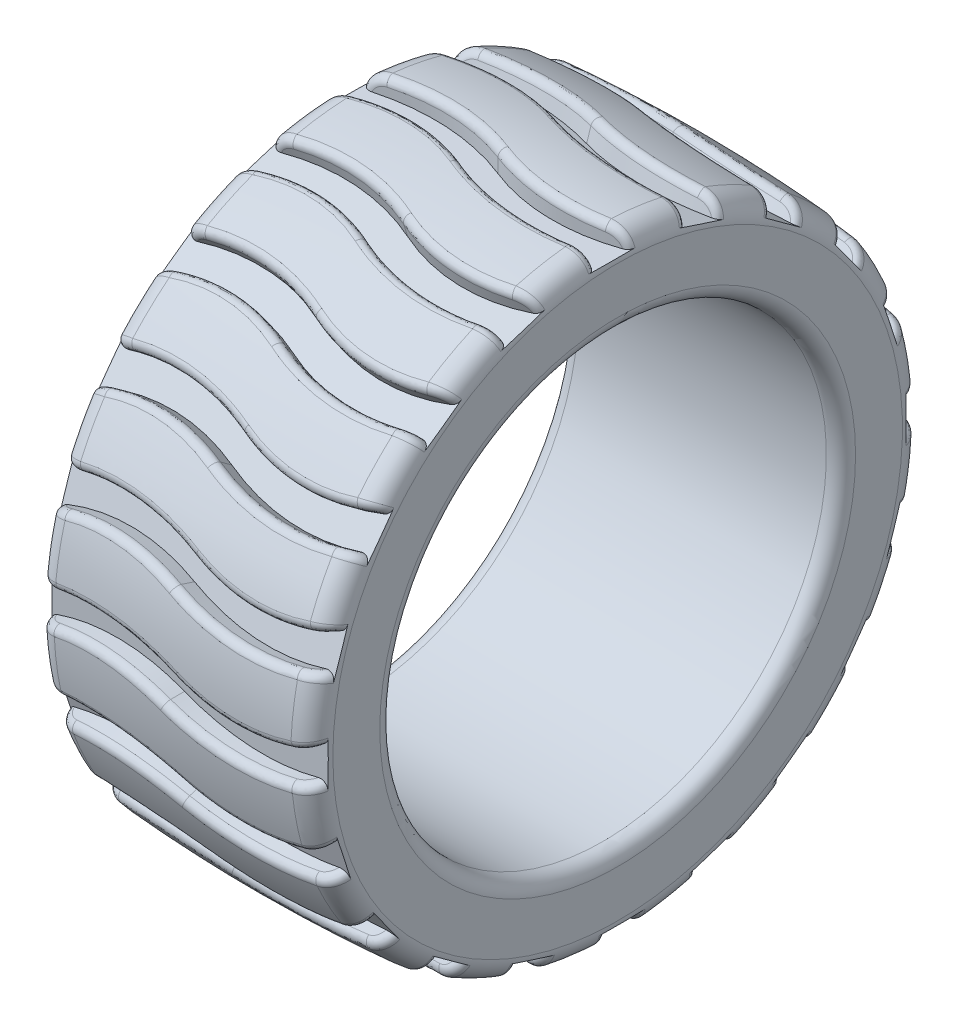
from build123d import *

# Parameters (mm, degrees)
CONG_1_R                           = 1.5
CONG_2_R                           = 1
ENL_V_START                        = 21.3
ENL_V_MAT_EXTRU_1_DEPTH            = 1.5
CONG_3_R                           = 0.5
R_P_TITION_CIRCULAIRE1_COUNT       = 20
CONG_3_OF_R_P_TITION_CIRCULAIRE1_R = 0.5


with BuildPart() as part:
    # Esquisse1 → Révolution1 (revolve)
    with BuildSketch(Plane.XY, mode=Mode.PRIVATE) as r_volution1_sk:
        with BuildLine():
            Line((-9.5, 20.9), (-9.5, 15.3))
            Line((-9.5, 15.3), (9.5, 15.3))
            Line((9.5, 15.3), (9.5, 20.9))
            ThreePointArc((9.5, 20.9), (0, 21.3), (-9.5, 20.9))
        make_face()
    revolve(r_volution1_sk.sketch.rotate(Axis((-10.45, 0, 0), (1, 0, 0)), 90), axis=Axis((-10.45, 0, 0), (1, 0, 0)))

    # Congé1
    cong_1_edges = [part.edges().sort_by_distance(p)[0] for p in [
        (-9.5, 0, -20.9),
        (9.5, 0, -20.9),
    ]]
    fillet(cong_1_edges, radius=CONG_1_R)

    # Congé2
    cong_2_edges = [part.edges().sort_by_distance(p)[0] for p in [
        (-9.5, 0, -15.3),
        (9.5, 0, -15.3),
    ]]
    fillet(cong_2_edges, radius=CONG_2_R)

    # Esquisse3 → Enlèv. mat.-Extru.1 (cut)
    with BuildSketch(Plane(origin=(0, 0, 0), x_dir=(1, 0, 0), z_dir=(0, 1, 0)).offset(ENL_V_START)):
        with BuildLine():
            Line((-9.628981596, -0.928625513), (-10.371018404, 0.928625513))
            ThreePointArc((-10.371018404, 0.928625513), (-5, 1.961872591), (0.371018404, 0.928625513))
            ThreePointArc((0.371018404, 0.928625513), (5, 0.038127409), (9.628981596, 0.928625513))
            Line((9.628981596, 0.928625513), (10.371018404, -0.928625513))
            ThreePointArc((10.371018404, -0.928625513), (5, -1.961872591), (-0.371018404, -0.928625513))
            ThreePointArc((-0.371018404, -0.928625513), (-5, -0.038127409), (-9.628981596, -0.928625513))
        make_face()
    enl_v_mat_extru_1 = extrude(amount=-ENL_V_MAT_EXTRU_1_DEPTH, mode=Mode.SUBTRACT)

    # Congé3
    cong_3_edges = [part.edges().sort_by_distance(p)[0] for p in [
        (-8.98199894, 20.634990629, 0.690641919),
        (-8.974112077, 20.605433709, -1.405695754),
        (8.974112924, 20.605435371, 1.405695512),
        (8.981998412, 20.6349899, -0.690641741),
        (3.817385363, 21.14912319, 1.913486356),
        (-4.202402626, 21.221743744, 0.063648066),
        (-3.817385436, 21.149123187, -1.913486362),
        (4.202402654, 21.221743743, -0.063648065),
    ]]
    fillet(cong_3_edges, radius=CONG_3_R)

    # Répétition circulaire1: Enlèv. mat.-Extru.1 ×20 about axis
    r_p_tition_circulaire1_axis = Axis((-10.45, 0, 0), (1, 0, 0))
    for i in range(1, R_P_TITION_CIRCULAIRE1_COUNT):
        add(enl_v_mat_extru_1.rotate(r_p_tition_circulaire1_axis, i * 360 / R_P_TITION_CIRCULAIRE1_COUNT), mode=Mode.SUBTRACT)

    # Congé3 of Répétition circulaire1
    cong_3_of_r_p_tition_circulaire1_edges = [part.edges().sort_by_distance(p)[0] for p in [
        (-8.98199894, 19.411622212, 7.03340228),
        (-8.974112077, 20.031315877, 5.030533086),
        (8.974112924, 19.162549779, 7.704325583),
        (8.981998412, 19.838461643, 5.71972323),
        (3.817385363, 19.522711621, 8.355272149),
        (-4.202402626, 20.163409341, 6.618412375),
        (-3.817385436, 20.705311225, 4.715604808),
        (4.202402654, 20.202746007, 6.49734656),
        (-8.98199894, 16.288108963, 12.687684222),
        (-8.974112077, 17.496393281, 10.974338298),
        (8.974112924, 15.8439003, 13.248802586),
        (8.981998412, 17.100006537, 11.570201839),
        (3.817385363, 15.985281016, 13.97918569),
        (-4.202402626, 17.131339944, 12.525320368),
        (-3.817385436, 18.234719138, 10.883099723),
        (4.202402654, 17.206162732, 12.422335634),
        (-8.98199894, 11.570202124, 17.100007232),
        (-8.974112077, 13.248801805, 15.843898814),
        (8.974112924, 10.97433947, 17.496394483),
        (8.981998412, 12.687683649, 16.288108478),
        (3.817385363, 10.883099729, 18.234719137),
        (-4.202402626, 12.422335633, 17.206162734),
        (-3.817385436, 13.979185693, 15.98528101),
        (4.202402654, 12.525320366, 17.131339945),
        (-8.98199894, 5.719723286, 19.838462392),
        (-8.974112077, 7.704325299, 19.162548123),
        (8.974112924, 5.030533829, 20.031317383),
        (8.981998412, 7.033401886, 19.411621573),
        (3.817385363, 4.715604814, 20.705311226),
        (-4.202402626, 6.497346559, 20.202746009),
        (-3.817385436, 8.355272154, 19.522711616),
        (4.202402654, 6.618412373, 20.16340934),
        (-8.98199894, -0.690641919, 20.634990629),
        (-8.974112077, 1.405695754, 20.605433709),
        (8.974112924, -1.405695512, 20.605435371),
        (8.981998412, 0.690641741, 20.6349899),
        (3.817385363, -1.913486356, 21.14912319),
        (-4.202402626, -0.063648066, 21.221743744),
        (-3.817385436, 1.913486362, 21.149123187),
        (4.202402654, 0.063648065, 21.221743743),
        (-8.98199894, -7.03340228, 19.411622212),
        (-8.974112077, -5.030533086, 20.031315877),
        (8.974112924, -7.704325583, 19.162549779),
        (8.981998412, -5.71972323, 19.838461643),
        (3.817385363, -8.355272149, 19.522711621),
        (-4.202402626, -6.618412375, 20.163409341),
        (-3.817385436, -4.715604808, 20.705311225),
        (4.202402654, -6.49734656, 20.202746007),
        (-8.98199894, -12.687684222, 16.288108963),
        (-8.974112077, -10.974338298, 17.496393281),
        (8.974112924, -13.248802586, 15.8439003),
        (8.981998412, -11.570201839, 17.100006537),
        (3.817385363, -13.97918569, 15.985281016),
        (-4.202402626, -12.525320368, 17.131339944),
        (-3.817385436, -10.883099723, 18.234719138),
        (4.202402654, -12.422335634, 17.206162732),
        (-8.98199894, -17.100007232, 11.570202124),
        (-8.974112077, -15.843898814, 13.248801805),
        (8.974112924, -17.496394483, 10.97433947),
        (8.981998412, -16.288108478, 12.687683649),
        (3.817385363, -18.234719137, 10.883099729),
        (-4.202402626, -17.206162734, 12.422335633),
        (-3.817385436, -15.98528101, 13.979185693),
        (4.202402654, -17.131339945, 12.525320366),
        (-8.98199894, -19.838462392, 5.719723286),
        (-8.974112077, -19.162548123, 7.704325299),
        (8.974112924, -20.031317383, 5.030533829),
        (8.981998412, -19.411621573, 7.033401886),
        (3.817385363, -20.705311226, 4.715604814),
        (-4.202402626, -20.202746009, 6.497346559),
        (-3.817385436, -19.522711616, 8.355272154),
        (4.202402654, -20.16340934, 6.618412373),
        (-8.98199894, -20.634990629, -0.690641919),
        (-8.974112077, -20.605433709, 1.405695754),
        (8.974112924, -20.605435371, -1.405695512),
        (8.981998412, -20.6349899, 0.690641741),
        (3.817385363, -21.14912319, -1.913486356),
        (-4.202402626, -21.221743744, -0.063648066),
        (-3.817385436, -21.149123187, 1.913486362),
        (4.202402654, -21.221743743, 0.063648065),
        (-8.98199894, -19.411622212, -7.03340228),
        (-8.974112077, -20.031315877, -5.030533086),
        (8.974112924, -19.162549779, -7.704325583),
        (8.981998412, -19.838461643, -5.71972323),
        (3.817385363, -19.522711621, -8.355272149),
        (-4.202402626, -20.163409341, -6.618412375),
        (-3.817385436, -20.705311225, -4.715604808),
        (4.202402654, -20.202746007, -6.49734656),
        (-8.98199894, -16.288108963, -12.687684222),
        (-8.974112077, -17.496393281, -10.974338298),
        (8.974112924, -15.8439003, -13.248802586),
        (8.981998412, -17.100006537, -11.570201839),
        (3.817385363, -15.985281016, -13.97918569),
        (-4.202402626, -17.131339944, -12.525320368),
        (-3.817385436, -18.234719138, -10.883099723),
        (4.202402654, -17.206162732, -12.422335634),
        (-8.98199894, -11.570202124, -17.100007232),
        (-8.974112077, -13.248801805, -15.843898814),
        (8.974112924, -10.97433947, -17.496394483),
        (8.981998412, -12.687683649, -16.288108478),
        (3.817385363, -10.883099729, -18.234719137),
        (-4.202402626, -12.422335633, -17.206162734),
        (-3.817385436, -13.979185693, -15.98528101),
        (4.202402654, -12.525320366, -17.131339945),
        (-8.98199894, -5.719723286, -19.838462392),
        (-8.974112077, -7.704325299, -19.162548123),
        (8.974112924, -5.030533829, -20.031317383),
        (8.981998412, -7.033401886, -19.411621573),
        (3.817385363, -4.715604814, -20.705311226),
        (-4.202402626, -6.497346559, -20.202746009),
        (-3.817385436, -8.355272154, -19.522711616),
        (4.202402654, -6.618412373, -20.16340934),
        (-8.98199894, 0.690641919, -20.634990629),
        (-8.974112077, -1.405695754, -20.605433709),
        (8.974112924, 1.405695512, -20.605435371),
        (8.981998412, -0.690641741, -20.6349899),
        (3.817385363, 1.913486356, -21.14912319),
        (-4.202402626, 0.063648066, -21.221743744),
        (-3.817385436, -1.913486362, -21.149123187),
        (4.202402654, -0.063648065, -21.221743743),
        (-8.98199894, 7.03340228, -19.411622212),
        (-8.974112077, 5.030533086, -20.031315877),
        (8.974112924, 7.704325583, -19.162549779),
        (8.981998412, 5.71972323, -19.838461643),
        (3.817385363, 8.355272149, -19.522711621),
        (-4.202402626, 6.618412375, -20.163409341),
        (-3.817385436, 4.715604808, -20.705311225),
        (4.202402654, 6.49734656, -20.202746007),
        (-8.98199894, 12.687684222, -16.288108963),
        (-8.974112077, 10.974338298, -17.496393281),
        (8.974112924, 13.248802586, -15.8439003),
        (8.981998412, 11.570201839, -17.100006537),
        (3.817385363, 13.97918569, -15.985281016),
        (-4.202402626, 12.525320368, -17.131339944),
        (-3.817385436, 10.883099723, -18.234719138),
        (4.202402654, 12.422335634, -17.206162732),
        (-8.98199894, 17.100007232, -11.570202124),
        (-8.974112077, 15.843898814, -13.248801805),
        (8.974112924, 17.496394483, -10.97433947),
        (8.981998412, 16.288108478, -12.687683649),
        (3.817385363, 18.234719137, -10.883099729),
        (-4.202402626, 17.206162734, -12.422335633),
        (-3.817385436, 15.98528101, -13.979185693),
        (4.202402654, 17.131339945, -12.525320366),
        (-8.98199894, 19.838462392, -5.719723286),
        (-8.974112077, 19.162548123, -7.704325299),
        (8.974112924, 20.031317383, -5.030533829),
        (8.981998412, 19.411621573, -7.033401886),
        (3.817385363, 20.705311226, -4.715604814),
        (-4.202402626, 20.202746009, -6.497346559),
        (-3.817385436, 19.522711616, -8.355272154),
        (4.202402654, 20.16340934, -6.618412373),
    ]]
    fillet(cong_3_of_r_p_tition_circulaire1_edges, radius=CONG_3_OF_R_P_TITION_CIRCULAIRE1_R)


solid = part.part
